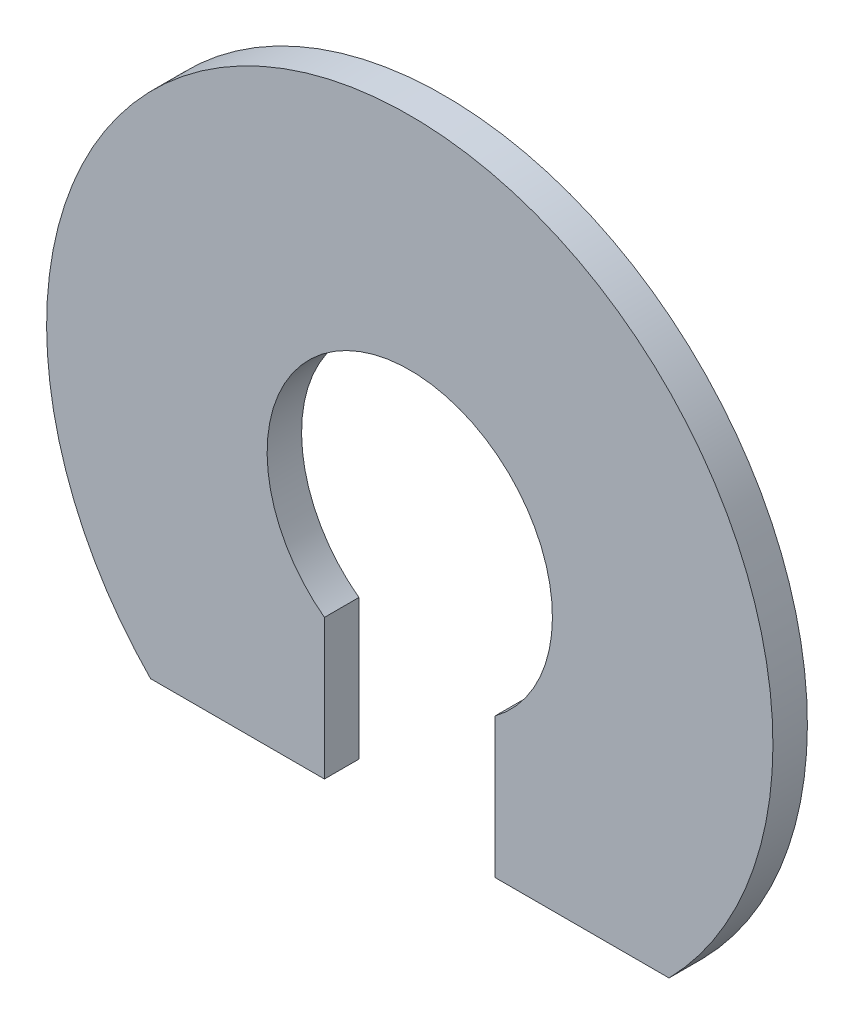
from build123d import *

# Parameters (mm, degrees)
SKETCH1_R      = 6.6929
SKETCH1_R_2    = 2.6289
EXTRUDE1_DEPTH = 0.635
EXTRUDE2_START = -0.635
EXTRUDE2_DEPTH = 0.635
SKETCH5_W      = 3.145443006
SKETCH5_H      = 4.115631968
EXTRUDE3_DEPTH = 0.635


# Read off the part's stored shape, not the designer's step: Extrude2
with BuildPart() as part:
    # Sketch1 → Extrude1 (new body)
    with BuildSketch(Plane.XY):
        Circle(SKETCH1_R)
        Circle(SKETCH1_R_2, mode=Mode.SUBTRACT)
    extrude(amount=EXTRUDE1_DEPTH)

    # Extrude2 outline → Extrude2 (cut)
    with BuildSketch(Plane.XY.offset(0.635).offset(EXTRUDE2_START)):
        with BuildLine():
            Line((4.778033454, -4.686715984), (-4.778033454, -4.686715984))
            ThreePointArc((-4.778033454, -4.686715984), (0, -6.6929), (4.778033454, -4.686715984))
        make_face()
    extrude(amount=EXTRUDE2_DEPTH, mode=Mode.SUBTRACT)

    # Sketch5 → Extrude3 (cut)
    with BuildSketch(Plane.XY.offset(0.635)):
        with Locations((0, -2.6289)):
            Rectangle(SKETCH5_W, SKETCH5_H)
    extrude(amount=-EXTRUDE3_DEPTH, mode=Mode.SUBTRACT)


solid = part.part
